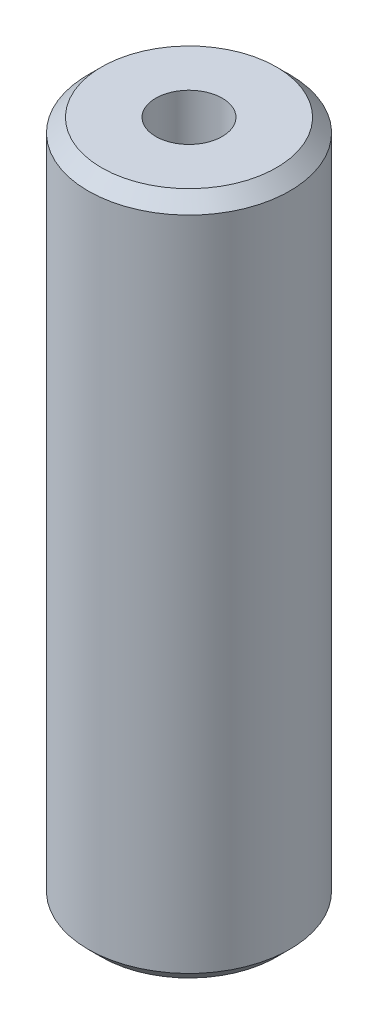
from build123d import *

# Parameters (mm, degrees)
SKETCH1_R           = 10
BOSS_EXTRUDE1_DEPTH = 67.807221097
SKETCH2_R           = 3.297487591
CUT_EXTRUDE1_DEPTH  = 70.266292184
CHAMFER1_SIZE       = 1.330463076


with BuildPart() as part:
    # Sketch1 → Boss-Extrude1 (new body)
    with BuildSketch(Plane(origin=(0, 0, 0), x_dir=(1, 0, 0), z_dir=(0, 1, 0))):
        Circle(SKETCH1_R)
    extrude(amount=BOSS_EXTRUDE1_DEPTH)

    # Sketch2 → Cut-Extrude1 (cut, through all)
    with BuildSketch(Plane(origin=(0, 0, 0), x_dir=(1, 0, 0), z_dir=(0, 1, 0))):
        Circle(SKETCH2_R)
    extrude(amount=CUT_EXTRUDE1_DEPTH, mode=Mode.SUBTRACT)

    # Chamfer1
    chamfer1_edges = [part.edges().sort_by_distance(p)[0] for p in [
        (-10, 67.807221097, 0),
        (-10, 0, 0),
    ]]
    chamfer(chamfer1_edges, length=CHAMFER1_SIZE)


solid = part.part
